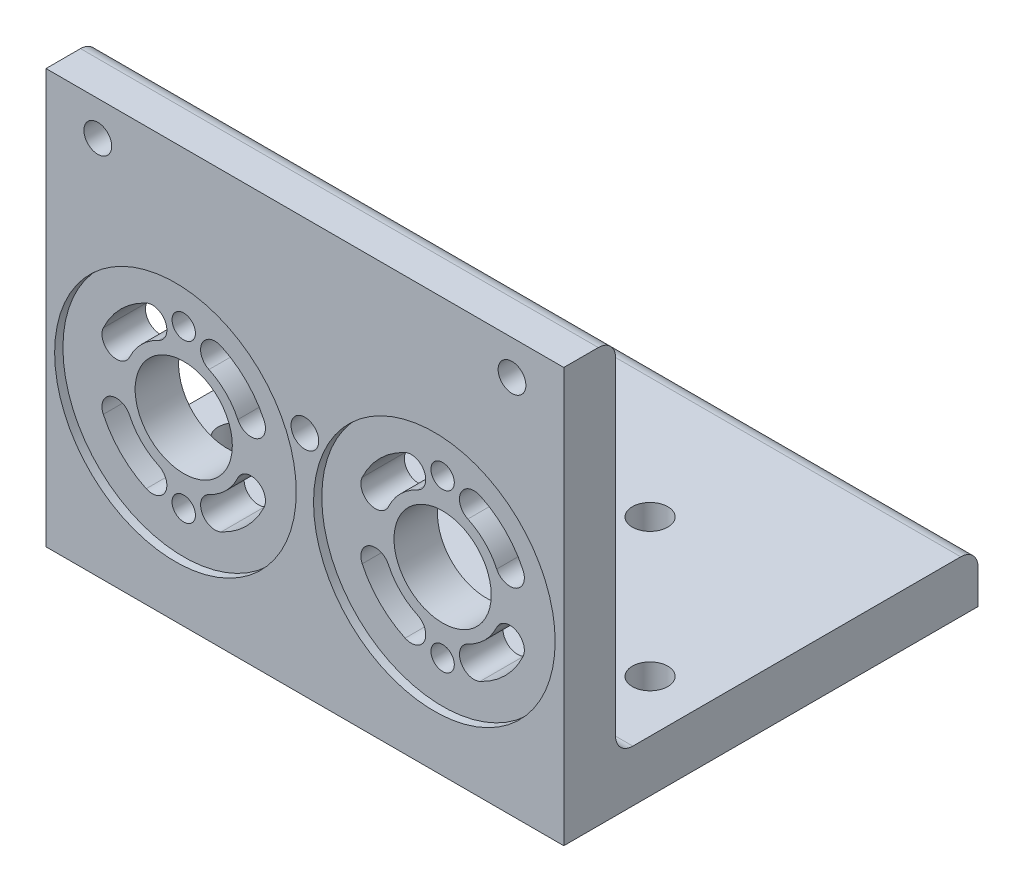
from build123d import *

# Parameters (mm, degrees)
BOSS_EXTRUDE1_DEPTH     = 47.625
FILLET1_R               = 3.175
F_1_4_20_TAPPED_HOLE1_D = 5.1054
SKETCH6_R               = 8.9408
CUT_EXTRUDE1_DEPTH      = 118.817743252
SKETCH7_R               = 22.225
CUT_EXTRUDE2_DEPTH      = 1.524
F_1_4_20_TAPPED_HOLE2_D = 5.1054
M4_CLEARANCE_HOLE1_D    = 4.3
CUT_EXTRUDE3_DEPTH      = 140.693552859
CIRPATTERN1_START       = -9.525
CIRPATTERN1_DEPTH       = 8.001
F_1_4_CLEARANCE_HOLE1_D = 6.5278


# Read off the part's stored shape, not the designer's step: CirPattern1
with BuildPart() as part:
    # Sketch1 → Boss-Extrude1 (new, symmetric)
    with BuildSketch(Plane(origin=(0, 0, 0), x_dir=(0, 0, -1), z_dir=(1, 0, 0))):
        Polygon((0, 76.2), (0, 0), (76.2, 0), (76.2, 9.525), (9.525, 9.525), (9.525, 76.2), align=None)
    extrude(amount=BOSS_EXTRUDE1_DEPTH, both=True)

    # Fillet1
    fillet1_edges = [part.edges().sort_by_distance(p)[0] for p in [
        (0, 76.2, -9.525),
        (0, 9.525, -9.525),
        (0, 9.525, -76.2),
    ]]
    fillet(fillet1_edges, radius=FILLET1_R)

    # 1/4-20 Tapped Hole1 (through all)
    with Locations(Plane.XY):
        with Locations((-38.1, 69.85), (38.1, 69.85)):
            Hole(F_1_4_20_TAPPED_HOLE1_D / 2)

    # Sketch6 → Cut-Extrude1 (cut, through all)
    with BuildSketch(Plane.XY):
        with Locations((-23.8125, 31.75)):
            Circle(SKETCH6_R)
        with Locations((23.8125, 31.75)):
            Circle(SKETCH6_R)
    extrude(amount=-CUT_EXTRUDE1_DEPTH, mode=Mode.SUBTRACT)

    # Sketch7 → Cut-Extrude2 (cut)
    with BuildSketch(Plane.XY):
        with Locations((-23.8125, 31.75)):
            Circle(SKETCH7_R)
        with Locations((23.8125, 31.75)):
            Circle(SKETCH7_R)
    extrude(amount=-CUT_EXTRUDE2_DEPTH, mode=Mode.SUBTRACT)

    # 1/4-20 Tapped Hole2 (through all)
    with Locations(Plane(origin=(0, 0, -9.525), x_dir=(-1, 0, 0), z_dir=(0, 0, -1))):
        with Locations((0, 41.91)):
            Hole(F_1_4_20_TAPPED_HOLE2_D / 2)

    # M4 Clearance Hole1 (through all)
    with Locations(Plane(origin=(-35.918168185, -13.740381004, -9.525), x_dir=(-1, 0, 0), z_dir=(0, 0, -1))):
        with Locations((-59.730668185, 59.990381004), (-59.730668185, 30.990381004), (-12.105668185, 30.990381004), (-12.105668185, 59.990381004)):
            Hole(M4_CLEARANCE_HOLE1_D / 2)

    # Sketch12 → Cut-Extrude3 (cut, through all)
    with BuildSketch(Plane(origin=(-35.918168185, -13.740381004, -9.525), x_dir=(-1, 0, 0), z_dir=(0, 0, -1))):
        with BuildLine():
            ThreePointArc((-66.626530361, 60.278605165), (-71.268529533, 57.028242353), (-74.518892346, 52.386243181))
            ThreePointArc((-74.518892346, 52.386243181), (-73.228892382, 48.841997409), (-69.68464661, 50.131997373))
            ThreePointArc((-69.68464661, 50.131997373), (-67.496821962, 53.256534782), (-64.372284553, 55.444359429))
            ThreePointArc((-64.372284553, 55.444359429), (-63.082284589, 58.988605201), (-66.626530361, 60.278605165))
        make_face()
    cut_extrude3 = extrude(amount=-CUT_EXTRUDE3_DEPTH, mode=Mode.SUBTRACT)

    # CirPattern1 outline → CirPattern1 (cut)
    with BuildSketch(Plane.XY.offset(CIRPATTERN1_START)):
        with BuildLine():
            ThreePointArc((9.024275839, 38.645862177), (10.314275803, 35.101616405), (13.858521575, 36.391616369))
            ThreePointArc((13.858521575, 36.391616369), (16.046346222, 39.516153778), (19.170883631, 41.703978425))
            ThreePointArc((19.170883631, 41.703978425), (20.460883595, 45.248224197), (16.916637823, 46.538224161))
            ThreePointArc((16.916637823, 46.538224161), (12.274638651, 43.287861349), (9.024275839, 38.645862177))
        make_face()
        with BuildLine():
            ThreePointArc((38.600724161, 24.854137823), (37.310724197, 28.398383595), (33.766478425, 27.108383631))
            ThreePointArc((33.766478425, 27.108383631), (31.578653778, 23.983846222), (28.454116369, 21.796021575))
            ThreePointArc((28.454116369, 21.796021575), (27.164116405, 18.251775803), (30.708362177, 16.961775839))
            ThreePointArc((30.708362177, 16.961775839), (35.350361349, 20.212138651), (38.600724161, 24.854137823))
        make_face()
        with BuildLine():
            ThreePointArc((16.916637823, 16.961775839), (20.460883595, 18.251775803), (19.170883631, 21.796021575))
            ThreePointArc((19.170883631, 21.796021575), (16.046346222, 23.983846222), (13.858521575, 27.108383631))
            ThreePointArc((13.858521575, 27.108383631), (10.314275803, 28.398383595), (9.024275839, 24.854137823))
            ThreePointArc((9.024275839, 24.854137823), (12.274638651, 20.212138651), (16.916637823, 16.961775839))
        make_face()
    cirpattern1 = extrude(amount=CIRPATTERN1_DEPTH, mode=Mode.SUBTRACT)

    # Mirror1: Cut-Extrude3, CirPattern1 across plane
    add(cut_extrude3.mirror(Plane(origin=(0, 0, 0), x_dir=(0, 0, 1), z_dir=(1, 0, 0))), mode=Mode.SUBTRACT)
    add(cirpattern1.mirror(Plane(origin=(0, 0, 0), x_dir=(0, 0, 1), z_dir=(1, 0, 0))), mode=Mode.SUBTRACT)

    # 1/4 Clearance Hole1 (through all)
    with Locations(Plane(origin=(0, 9.525, 0), x_dir=(1, 0, 0), z_dir=(0, 1, 0))):
        with Locations((-38.1, 25.4), (38.1, 25.4), (-12.7, 50.8), (12.7, 50.8)):
            Hole(F_1_4_CLEARANCE_HOLE1_D / 2)


solid = part.part
